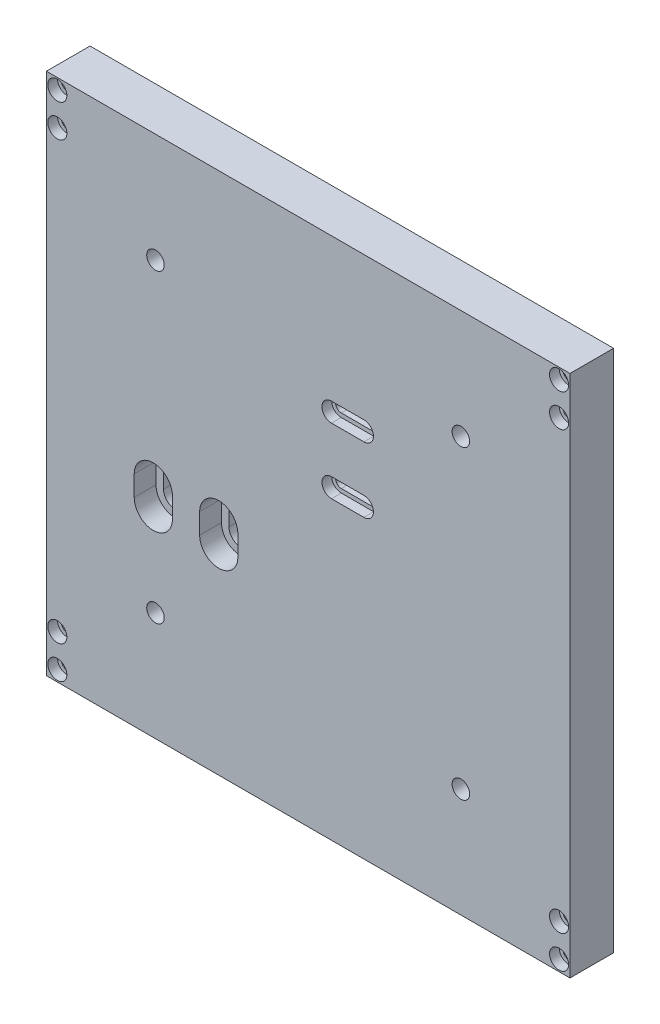
from build123d import *

# Parameters (mm, degrees)
SKETCH1_W                                      = 152.4
SKETCH1_H                                      = 152.4
BOSS_EXTRUDE1_DEPTH                            = 12.7
F_1_4_20_TAPPED_HOLE1_D                        = 5.1054
CBORE_FOR_4_SOCKET_HEAD_CAP_SCREW1_D           = 3.2639
CBORE_FOR_4_SOCKET_HEAD_CAP_SCREW1_CBORE_D     = 5.55752
CBORE_FOR_4_SOCKET_HEAD_CAP_SCREW1_CBORE_DEPTH = 2.8448
F_2_56_TAPPED_HOLE1_D                          = 1.778
F_2_56_TAPPED_HOLE1_DEPTH                      = 5.7404
F_2_56_TAPPED_HOLE1_TIP                        = 0.53416509
F_2_56_TAPPED_HOLE2_D                          = 1.778
F_2_56_TAPPED_HOLE2_DEPTH                      = 5.7404
F_2_56_TAPPED_HOLE2_TIP                        = 0.53416509
CBORE_SLOT_FOR_4_SOCKET_HEAD_CAP_SCREW1_DEPTH  = 12.7
CBORE_START                                    = 9.8552
CBORE_SLOT_FOR_4_SOCKET_HEAD_CAP_SC_3_DEPTH    = 2.8448
CBORE_START_2                                  = 6.35
CBORE_SLOT_FOR_1_4_SOCKET_HEAD_CAP_SCREW_DEPTH = 6.35
CBORE_SLOT_FOR_1_4_SOCKET_HEAD_CAP_S_3_DEPTH   = 6.35


# Read off the part's stored shape, not the designer's step: CBORE SLOT for #4 Socket Head Cap Screw1, CBORE SLOT for 1/4 Socket Head Cap Screw3
with BuildPart() as part:
    # Sketch1 → Boss-Extrude1 (new body)
    with BuildSketch(Plane.XY):
        Rectangle(SKETCH1_W, SKETCH1_H)
    extrude(amount=BOSS_EXTRUDE1_DEPTH)

    # 1/4-20 Tapped Hole1 (through all)
    with Locations(Plane.XY.offset(12.7)):
        with Locations((44.45, 44.45), (44.45, -44.45), (-44.45, -44.45), (-44.45, 44.45)):
            Hole(F_1_4_20_TAPPED_HOLE1_D / 2)

    # CBORE for #4 Socket Head Cap Screw1 (through all)
    with Locations(Plane.XY.offset(12.7)):
        with Locations((-73.025, 63.5), (-73.025, 73.025), (73.025, 63.5), (73.025, 73.025), (73.025, -63.5), (73.025, -73.025), (-73.025, -63.5), (-73.025, -73.025)):
            CounterBoreHole(CBORE_FOR_4_SOCKET_HEAD_CAP_SCREW1_D / 2, CBORE_FOR_4_SOCKET_HEAD_CAP_SCREW1_CBORE_D / 2, CBORE_FOR_4_SOCKET_HEAD_CAP_SCREW1_CBORE_DEPTH)

    # #2-56 Tapped Hole1
    with Locations(Plane(origin=(0, 0, 0), x_dir=(-1, 0, 0), z_dir=(0, 0, -1))):
        with Locations((-63.5, -63.5), (-63.5, -34.163), (-29.083, -63.5), (-29.083, -34.163)):
            Hole(F_2_56_TAPPED_HOLE1_D / 2, depth=F_2_56_TAPPED_HOLE1_DEPTH)
            with Locations((0, 0, -(F_2_56_TAPPED_HOLE1_DEPTH + F_2_56_TAPPED_HOLE1_TIP / 2))):  # 118° drill point
                Cone(0, F_2_56_TAPPED_HOLE1_D / 2, F_2_56_TAPPED_HOLE1_TIP, mode=Mode.SUBTRACT)

    # #2-56 Tapped Hole2
    with Locations(Plane(origin=(0, 0, 0), x_dir=(-1, 0, 0), z_dir=(0, 0, -1))):
        with Locations((-63.5, 6.5278), (-63.5, 63.5), (-29.3878, 63.5), (-29.3878, 6.5278)):
            Hole(F_2_56_TAPPED_HOLE2_D / 2, depth=F_2_56_TAPPED_HOLE2_DEPTH)
            with Locations((0, 0, -(F_2_56_TAPPED_HOLE2_DEPTH + F_2_56_TAPPED_HOLE2_TIP / 2))):  # 118° drill point
                Cone(0, F_2_56_TAPPED_HOLE2_D / 2, F_2_56_TAPPED_HOLE2_TIP, mode=Mode.SUBTRACT)

    # CBORE SLOT for _4 Socket Head Cap Sc 2 → CBORE SLOT for #4 Socket Head Cap Screw1 (cut)
    with BuildSketch(Plane.XY):
        with BuildLine():
            Line((6.78815, 30.11805), (16.22425, 30.11805))
            ThreePointArc((16.22425, 30.11805), (17.8562, 31.75), (16.22425, 33.38195))
            Line((16.22425, 33.38195), (6.78815, 33.38195))
            ThreePointArc((6.78815, 33.38195), (5.1562, 31.75), (6.78815, 30.11805))
        make_face()
        with BuildLine():
            Line((6.78815, 11.06805), (16.22425, 11.06805))
            ThreePointArc((16.22425, 11.06805), (17.8562, 12.7), (16.22425, 14.33195))
            Line((16.22425, 14.33195), (6.78815, 14.33195))
            ThreePointArc((6.78815, 14.33195), (5.1562, 12.7), (6.78815, 11.06805))
        make_face()
    extrude(amount=CBORE_SLOT_FOR_4_SOCKET_HEAD_CAP_SCREW1_DEPTH, mode=Mode.SUBTRACT)

    # CBORE SLOT for _4 Socket Head Cap Sc 3 o → CBORE SLOT for _4 Socket Head Cap Sc 3 (cut)
    # profile 1 of 2: a face of its own
    with BuildSketch(Plane.XY.offset(CBORE_START)):
        with BuildLine():
            Line((6.78815, 28.97124), (16.22425, 28.97124))
            ThreePointArc((16.22425, 28.97124), (19.00301, 31.75), (16.22425, 34.52876))
            Line((16.22425, 34.52876), (6.78815, 34.52876))
            ThreePointArc((6.78815, 34.52876), (4.00939, 31.75), (6.78815, 28.97124))
        make_face()
        with BuildLine():
            ThreePointArc((16.22425, 33.38195), (17.8562, 31.75), (16.22425, 30.11805))
            Line((16.22425, 30.11805), (6.78815, 30.11805))
            ThreePointArc((6.78815, 30.11805), (5.1562, 31.75), (6.78815, 33.38195))
            Line((6.78815, 33.38195), (16.22425, 33.38195))
        make_face(mode=Mode.SUBTRACT)
    # profile 2 of 2: a face of its own
    with BuildSketch(Plane.XY.offset(CBORE_START)):
        with BuildLine():
            Line((6.78815, 9.92124), (16.22425, 9.92124))
            ThreePointArc((16.22425, 9.92124), (19.00301, 12.7), (16.22425, 15.47876))
            Line((16.22425, 15.47876), (6.78815, 15.47876))
            ThreePointArc((6.78815, 15.47876), (4.00939, 12.7), (6.78815, 9.92124))
        make_face()
        with BuildLine():
            ThreePointArc((16.22425, 14.33195), (17.8562, 12.7), (16.22425, 11.06805))
            Line((16.22425, 11.06805), (6.78815, 11.06805))
            ThreePointArc((6.78815, 11.06805), (5.1562, 12.7), (6.78815, 14.33195))
            Line((6.78815, 14.33195), (16.22425, 14.33195))
        make_face(mode=Mode.SUBTRACT)
    extrude(amount=CBORE_SLOT_FOR_4_SOCKET_HEAD_CAP_SC_3_DEPTH, mode=Mode.SUBTRACT)

    # CBORE SLOT for 1_4 Socket Head Cap S 2 → CBORE SLOT for 1/4 Socket Head Cap Screw3 (cut)
    with BuildSketch(Plane.XY.offset(CBORE_START_2)):
        with BuildLine():
            Line((-39.52875, -18.4658), (-39.52875, -12.5222))
            ThreePointArc((-39.52875, -12.5222), (-45.085, -6.96595), (-50.64125, -12.5222))
            Line((-50.64125, -12.5222), (-50.64125, -18.4658))
            ThreePointArc((-50.64125, -18.4658), (-45.085, -24.02205), (-39.52875, -18.4658))
        make_face()
        with BuildLine():
            Line((-20.47875, -18.4658), (-20.47875, -12.5222))
            ThreePointArc((-20.47875, -12.5222), (-26.035, -6.96595), (-31.59125, -12.5222))
            Line((-31.59125, -12.5222), (-31.59125, -18.4658))
            ThreePointArc((-31.59125, -18.4658), (-26.035, -24.02205), (-20.47875, -18.4658))
        make_face()
    extrude(amount=CBORE_SLOT_FOR_1_4_SOCKET_HEAD_CAP_SCREW_DEPTH, mode=Mode.SUBTRACT)

    # CBORE SLOT for 1_4 Socket Head Cap S 3 o → CBORE SLOT for 1_4 Socket Head Cap S 3 (cut)
    with BuildSketch(Plane.XY):
        with BuildLine():
            Line((-41.7068, -18.4658), (-41.7068, -12.5222))
            ThreePointArc((-41.7068, -12.5222), (-45.085, -9.144), (-48.4632, -12.5222))
            Line((-48.4632, -12.5222), (-48.4632, -18.4658))
            ThreePointArc((-48.4632, -18.4658), (-45.085, -21.844), (-41.7068, -18.4658))
        make_face()
        with BuildLine():
            Line((-22.6568, -18.4658), (-22.6568, -12.5222))
            ThreePointArc((-22.6568, -12.5222), (-26.035, -9.144), (-29.4132, -12.5222))
            Line((-29.4132, -12.5222), (-29.4132, -18.4658))
            ThreePointArc((-29.4132, -18.4658), (-26.035, -21.844), (-22.6568, -18.4658))
        make_face()
    extrude(amount=CBORE_SLOT_FOR_1_4_SOCKET_HEAD_CAP_S_3_DEPTH, mode=Mode.SUBTRACT)


solid = part.part
